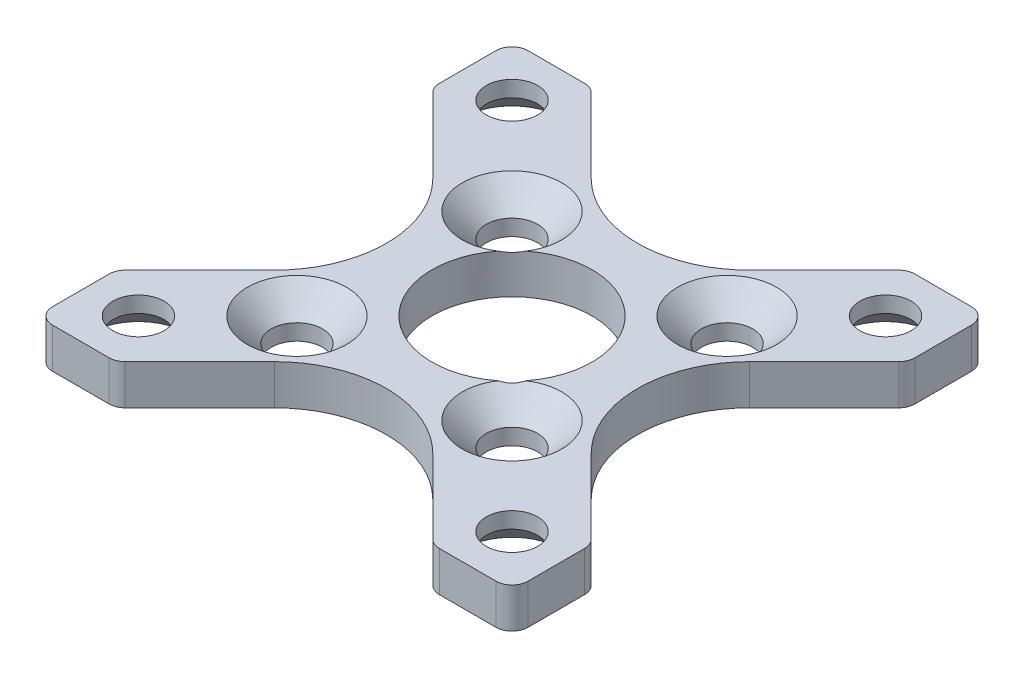
from build123d import *

# Parameters (mm, degrees)
SKETCH1_W           = 29.69848481
SKETCH1_H           = 29.69848481
SKETCH1_R           = 5
SKETCH1_R_2         = 1.6
BOSS_EXTRUDE1_DEPTH = 2.5
CUT_EXTRUDE1_DEPTH  = 22.148285983
FILLET3_R           = 1
CHAMFER1_SIZE       = 1.5


with BuildPart() as part:
    # Sketch1 → Boss-Extrude1 (new body)
    with BuildSketch(Plane(origin=(0, 0, 0), x_dir=(1, 0, 0), z_dir=(0, 1, 0))):
        Rectangle(SKETCH1_W, SKETCH1_H)
        with Locations(Location((0, 0, 0), (0, 0, 270))):
            Circle(SKETCH1_R, mode=Mode.SUBTRACT)
        with Locations(Location((-5.656854249, 5.656854249, 0), (0, 0, 270))):
            Circle(SKETCH1_R_2, mode=Mode.SUBTRACT)
        with Locations(Location((5.656854249, -5.656854249, 0), (0, 0, 270))):
            Circle(SKETCH1_R_2, mode=Mode.SUBTRACT)
        with Locations(Location((-6.717514421, -6.717514421, 0), (0, 0, 270))):
            Circle(SKETCH1_R_2, mode=Mode.SUBTRACT)
        with Locations(Location((6.717514421, 6.717514421, 0), (0, 0, 270))):
            Circle(SKETCH1_R_2, mode=Mode.SUBTRACT)
        with Locations(Location((-11.66726189, -11.66726189, 0), (0, 0, 270))):
            Circle(SKETCH1_R_2, mode=Mode.SUBTRACT)
        with Locations(Location((-11.66726189, 11.66726189, 0), (0, 0, 270))):
            Circle(SKETCH1_R_2, mode=Mode.SUBTRACT)
        with Locations(Location((11.66726189, 11.66726189, 0), (0, 0, 270))):
            Circle(SKETCH1_R_2, mode=Mode.SUBTRACT)
        with Locations(Location((11.66726189, -11.66726189, 0), (0, 0, 270))):
            Circle(SKETCH1_R_2, mode=Mode.SUBTRACT)
    extrude(amount=BOSS_EXTRUDE1_DEPTH)

    # Sketch2 → Cut-Extrude1 (cut, through all)
    with BuildSketch(Plane(origin=(0, 2.5, 0), x_dir=(1, 0, 0), z_dir=(0, 1, 0))):
        with BuildLine():
            Line((-9.899494937, 4.949747468), (-14.849242405, 9.899494937))
            Line((-14.849242405, 9.899494937), (-14.849242405, -9.899494937))
            Line((-14.849242405, -9.899494937), (-9.899494937, -4.949747468))
            ThreePointArc((-9.899494937, -4.949747468), (-7.849242405, 0), (-9.899494937, 4.949747468))
        make_face()
        with BuildLine():
            Line((9.899494937, 14.849242405), (-9.899494937, 14.849242405))
            Line((-9.899494937, 14.849242405), (-4.949747468, 9.899494937))
            ThreePointArc((-4.949747468, 9.899494937), (0, 7.849242405), (4.949747468, 9.899494937))
            Line((4.949747468, 9.899494937), (9.899494937, 14.849242405))
        make_face()
        with BuildLine():
            Line((14.849242405, -9.899494937), (14.849242405, 9.899494937))
            Line((14.849242405, 9.899494937), (9.899494937, 4.949747468))
            ThreePointArc((9.899494937, 4.949747468), (7.849242405, 0), (9.899494937, -4.949747468))
            Line((9.899494937, -4.949747468), (14.849242405, -9.899494937))
        make_face()
        with BuildLine():
            Line((-9.899494937, -14.849242405), (9.899494937, -14.849242405))
            Line((9.899494937, -14.849242405), (4.949747468, -9.899494937))
            ThreePointArc((4.949747468, -9.899494937), (0, -7.849242405), (-4.949747468, -9.899494937))
            Line((-4.949747468, -9.899494937), (-9.899494937, -14.849242405))
        make_face()
    extrude(amount=-CUT_EXTRUDE1_DEPTH, mode=Mode.SUBTRACT)

    # Fillet3
    fillet3_edges = [part.edges().sort_by_distance(p)[0] for p in [
        (14.849242405, 1.25, -9.899494937),
        (14.849242405, 1.25, 9.899494937),
        (14.849242405, 1.25, 14.849242405),
        (-14.849242405, 1.25, 14.849242405),
        (-14.849242405, 1.25, -14.849242405),
        (-9.899494937, 1.25, -14.849242405),
        (9.899494937, 1.25, -14.849242405),
        (14.849242405, 1.25, -14.849242405),
        (9.899494937, 1.25, 14.849242405),
        (-9.899494937, 1.25, 14.849242405),
        (-14.849242405, 1.25, 9.899494937),
        (-14.849242405, 1.25, -9.899494937),
    ]]
    fillet(fillet3_edges, radius=FILLET3_R)

    # Chamfer1
    # the kernel refuses this chamfer: 1.5 mm, written as the material it takes off along each edge
    with BuildSketch(Plane(origin=(-5.656854249, 2.5, -5.656854249), x_dir=(0, 0, 1), z_dir=(-1, 0, 0))) as chamfer1_piece_1:
        Polygon((1.6 + CHAMFER1_SIZE, 0), (1.6, -CHAMFER1_SIZE), (1.6, 0), align=None)
    revolve(axis=Axis((-5.656854249, 2.5, -5.656854249), (0, 1, 0)), mode=Mode.SUBTRACT)
    with BuildSketch(Plane(origin=(5.656854249, 2.5, 5.656854249), x_dir=(0, 0, 1), z_dir=(-1, 0, 0))) as chamfer1_piece_2:
        Polygon((1.6 + CHAMFER1_SIZE, 0), (1.6, -CHAMFER1_SIZE), (1.6, 0), align=None)
    revolve(axis=Axis((5.656854249, 2.5, 5.656854249), (0, 1, 0)), mode=Mode.SUBTRACT)
    with BuildSketch(Plane(origin=(-6.717514421, 2.5, 6.717514421), x_dir=(0, 0, 1), z_dir=(-1, 0, 0))) as chamfer1_piece_3:
        Polygon((1.6 + CHAMFER1_SIZE, 0), (1.6, -CHAMFER1_SIZE), (1.6, 0), align=None)
    revolve(axis=Axis((-6.717514421, 2.5, 6.717514421), (0, 1, 0)), mode=Mode.SUBTRACT)
    with BuildSketch(Plane(origin=(6.717514421, 2.5, -6.717514421), x_dir=(0, 0, 1), z_dir=(-1, 0, 0))) as chamfer1_piece_4:
        Polygon((1.6 + CHAMFER1_SIZE, 0), (1.6, -CHAMFER1_SIZE), (1.6, 0), align=None)
    revolve(axis=Axis((6.717514421, 2.5, -6.717514421), (0, 1, 0)), mode=Mode.SUBTRACT)
    with BuildSketch(Plane(origin=(-11.66726189, 0, 11.66726189), x_dir=(0, 0, 1), z_dir=(-1, 0, 0))) as chamfer1_piece_5:
        Polygon((1.6 + CHAMFER1_SIZE, 0), (1.6, CHAMFER1_SIZE), (1.6, 0), align=None)
    revolve(axis=Axis((-11.66726189, 0, 11.66726189), (0, 1, 0)), mode=Mode.SUBTRACT)
    with BuildSketch(Plane(origin=(-11.66726189, 0, -11.66726189), x_dir=(0, 0, 1), z_dir=(-1, 0, 0))) as chamfer1_piece_6:
        Polygon((1.6 + CHAMFER1_SIZE, 0), (1.6, CHAMFER1_SIZE), (1.6, 0), align=None)
    revolve(axis=Axis((-11.66726189, 0, -11.66726189), (0, 1, 0)), mode=Mode.SUBTRACT)
    with BuildSketch(Plane(origin=(11.66726189, 0, -11.66726189), x_dir=(0, 0, 1), z_dir=(-1, 0, 0))) as chamfer1_piece_7:
        Polygon((1.6 + CHAMFER1_SIZE, 0), (1.6, CHAMFER1_SIZE), (1.6, 0), align=None)
    revolve(axis=Axis((11.66726189, 0, -11.66726189), (0, 1, 0)), mode=Mode.SUBTRACT)
    with BuildSketch(Plane(origin=(11.66726189, 0, 11.66726189), x_dir=(0, 0, 1), z_dir=(-1, 0, 0))) as chamfer1_piece_8:
        Polygon((1.6 + CHAMFER1_SIZE, 0), (1.6, CHAMFER1_SIZE), (1.6, 0), align=None)
    revolve(axis=Axis((11.66726189, 0, 11.66726189), (0, 1, 0)), mode=Mode.SUBTRACT)


solid = part.part
